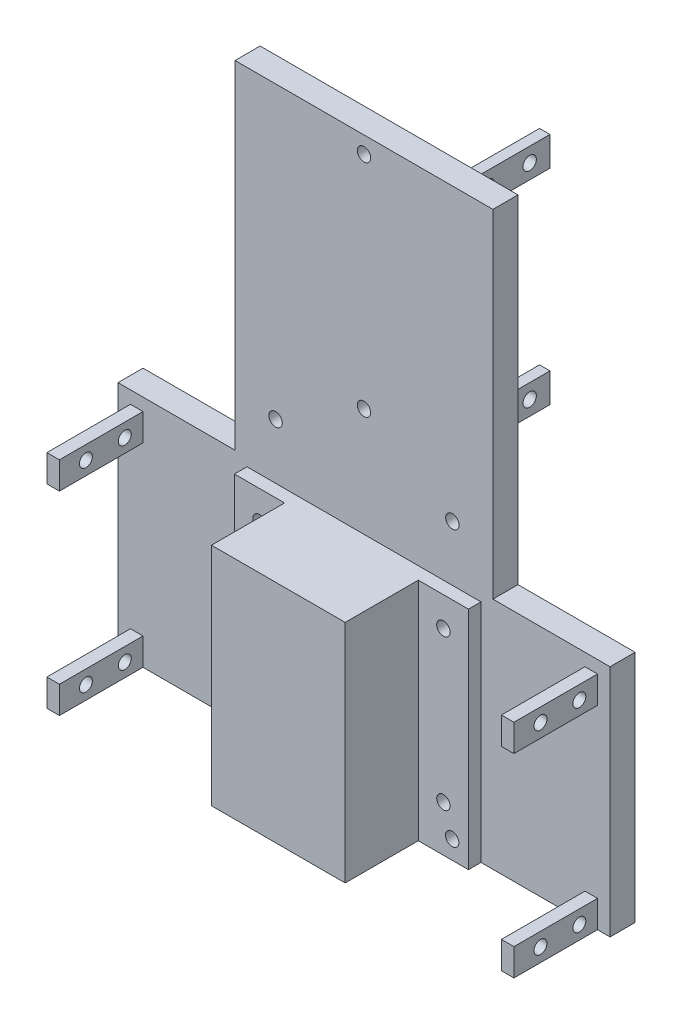
from build123d import *

# Parameters (mm, degrees)
SKETCH1_W           = 132
SKETCH1_H           = 160
BOSS_EXTRUDE1_DEPTH = 6
SKETCH3_W           = 32
SKETCH3_H           = 54
SKETCH3_W_2         = 26
SKETCH3_H_2         = 48
BOSS_EXTRUDE2_DEPTH = 17.5
SKETCH4_W           = 32
SKETCH4_H           = 54
BOSS_EXTRUDE3_DEPTH = 3
SKETCH5_W           = 25
SKETCH5_H           = 17
CUT_EXTRUDE1_DEPTH  = 3
SKETCH6_W           = 12
SKETCH6_H           = 54
BOSS_EXTRUDE4_DEPTH = 3
SKETCH7_R           = 1.6
CUT_EXTRUDE2_DEPTH  = 106.177231376
SKETCH8_W           = 3
SKETCH8_H           = 6.5
BOSS_EXTRUDE5_DEPTH = 20
SKETCH9_R           = 1.55
CUT_EXTRUDE3_DEPTH  = 6
SKETCH10_R          = 1.6
CUT_EXTRUDE4_DEPTH  = 108.043215572
SKETCH11_W          = 2.5
SKETCH11_H          = 7
BOSS_EXTRUDE6_DEPTH = 19.36
SKETCH12_R          = 1.6
CUT_EXTRUDE5_DEPTH  = 19.36
SKETCH13_W          = 3
SKETCH13_H          = 7
BOSS_EXTRUDE7_DEPTH = 15
SKETCH14_R          = 2
CUT_EXTRUDE6_DEPTH  = 15
CUT_EXTRUDE7_START  = -6
CUT_EXTRUDE7_DEPTH  = 6
SKETCH16_R          = 1.6
CUT_EXTRUDE8_DEPTH  = 15


# Read off the part's stored shape, not the designer's step: Cut-Extrude7
with BuildPart() as part:
    # Sketch1 → Boss-Extrude1 (new body)
    with BuildSketch(Plane.XY):
        Rectangle(SKETCH1_W, SKETCH1_H)
    extrude(amount=BOSS_EXTRUDE1_DEPTH)

    # Sketch3 → Boss-Extrude2 (add)
    with BuildSketch(Plane.XY.offset(6)):
        with Locations((0, -53)):
            Rectangle(SKETCH3_W, SKETCH3_H)
        with Locations((0, -53)):
            Rectangle(SKETCH3_W_2, SKETCH3_H_2, mode=Mode.SUBTRACT)
    extrude(amount=BOSS_EXTRUDE2_DEPTH)

    # Sketch4 → Boss-Extrude3 (add)
    with BuildSketch(Plane.XY.offset(23.5)):
        with Locations((0, -53)):
            Rectangle(SKETCH4_W, SKETCH4_H)
    extrude(amount=BOSS_EXTRUDE3_DEPTH)

    # Sketch5 → Cut-Extrude1 (cut)
    with BuildSketch(Plane.XZ.offset(80)):
        with Locations((0, 14.5)):
            Rectangle(SKETCH5_W, SKETCH5_H)
    extrude(amount=-CUT_EXTRUDE1_DEPTH, mode=Mode.SUBTRACT)

    # Sketch6 → Boss-Extrude4 (add)
    with BuildSketch(Plane.XY.offset(6)):
        with Locations((-22, -53)):
            Rectangle(SKETCH6_W, SKETCH6_H)
        with Locations((22, -53)):
            Rectangle(SKETCH6_W, SKETCH6_H)
    extrude(amount=BOSS_EXTRUDE4_DEPTH)

    # Sketch7 → Cut-Extrude2 (cut, through all)
    with BuildSketch(Plane.XY.offset(9)):
        with Locations((-22, -69)):
            Circle(SKETCH7_R)
        with Locations((-22, -33)):
            Circle(SKETCH7_R)
        with Locations(Location((22, -69, 0), (0, 0, 180))):
            Circle(SKETCH7_R)
        with Locations(Location((22, -33, 0), (0, 0, 180))):
            Circle(SKETCH7_R)
    extrude(amount=-CUT_EXTRUDE2_DEPTH, mode=Mode.SUBTRACT)

    # Sketch8 → Boss-Extrude5 (add)
    with BuildSketch(Plane.XY.offset(6)):
        with Locations((-54.38, -76.75)):
            Rectangle(SKETCH8_W, SKETCH8_H)
        with Locations((-54.38, -30.25)):
            Rectangle(SKETCH8_W, SKETCH8_H)
    boss_extrude5 = extrude(amount=BOSS_EXTRUDE5_DEPTH)

    # Sketch9 → Cut-Extrude3 (cut)
    with BuildSketch(Plane.ZY.offset(55.88)):
        with Locations((10.35, -76.75)):
            Circle(SKETCH9_R)
        with Locations((19.65, -76.75)):
            Circle(SKETCH9_R)
        with Locations((10.35, -30.25)):
            Circle(SKETCH9_R)
        with Locations((19.65, -30.25)):
            Circle(SKETCH9_R)
    cut_extrude3 = extrude(amount=-CUT_EXTRUDE3_DEPTH, mode=Mode.SUBTRACT)

    # Mirror1: Boss-Extrude5, Cut-Extrude3 across plane
    add(boss_extrude5.mirror(Plane(origin=(0, 0, 0), x_dir=(0, 0, 1), z_dir=(1, 0, 0))))
    add(cut_extrude3.mirror(Plane(origin=(0, 0, 0), x_dir=(0, 0, 1), z_dir=(1, 0, 0))), mode=Mode.SUBTRACT)

    # Sketch10 → Cut-Extrude4 (cut, through all)
    with BuildSketch(Plane(origin=(0, 0, 0), x_dir=(-1, 0, 0), z_dir=(0, 0, -1))):
        with Locations((-24.1, -75.572749788)):
            Circle(SKETCH10_R)
        with Locations((-21.15, -12.732749788)):
            Circle(SKETCH10_R)
        with Locations(Location((21.15, -12.732749788, 0), (0, 0, 180))):
            Circle(SKETCH10_R)
        with Locations((24.1, -75.572749788)):
            Circle(SKETCH10_R)
    extrude(amount=-CUT_EXTRUDE4_DEPTH, mode=Mode.SUBTRACT)

    # Sketch11 → Boss-Extrude6 (add)
    with BuildSketch(Plane(origin=(0, 0, 0), x_dir=(-1, 0, 0), z_dir=(0, 0, -1))):
        with Locations((-17.9, 1.267250212)):
            Rectangle(SKETCH11_W, SKETCH11_H)
        with Locations((-17.9, 50.267250212)):
            Rectangle(SKETCH11_W, SKETCH11_H)
    extrude(amount=BOSS_EXTRUDE6_DEPTH)

    # Sketch12 → Cut-Extrude5 (cut)
    with BuildSketch(Plane(origin=(19.15, 0, 0), x_dir=(0, 0, -1), z_dir=(1, 0, 0))):
        with Locations(Location((4.5, 50.267250212, 0), (0, 0, 90))):
            Circle(SKETCH12_R)
        with Locations(Location((14.5, 50.267250212, 0), (0, 0, 90))):
            Circle(SKETCH12_R)
        with Locations(Location((4.5, 1.267250212, 0), (0, 0, 90))):
            Circle(SKETCH12_R)
        with Locations(Location((14.5, 1.267250212, 0), (0, 0, 90))):
            Circle(SKETCH12_R)
    extrude(amount=-CUT_EXTRUDE5_DEPTH, mode=Mode.SUBTRACT)

    # Sketch13 → Boss-Extrude7 (add)
    with BuildSketch(Plane(origin=(0, 0, 0), x_dir=(-1, 0, 0), z_dir=(0, 0, -1))):
        with Locations((29.35, 35.967250212)):
            Rectangle(SKETCH13_W, SKETCH13_H)
    extrude(amount=BOSS_EXTRUDE7_DEPTH)

    # Sketch14 → Cut-Extrude6 (cut)
    with BuildSketch(Plane.ZY.offset(30.85)):
        with Locations((-9.9, 35.967250212)):
            Circle(SKETCH14_R)
    extrude(amount=-CUT_EXTRUDE6_DEPTH, mode=Mode.SUBTRACT)

    # Cut-Extrude7 outline → Cut-Extrude7 (cut)
    with BuildSketch(Plane(origin=(0, 0, 0), x_dir=(-1, 0, 0), z_dir=(0, 0, -1)).offset(CUT_EXTRUDE7_START)):
        Polygon((-30.85, 56.767250212), (30.85, 56.767250212), (30.85, -24), (58.88, -24), (58.88, -80), (66, -80), (66, 80), (-66, 80), (-66, -80), (-58.88, -80), (-58.88, -24), (-30.85, -24), align=None)
    extrude(amount=CUT_EXTRUDE7_DEPTH, mode=Mode.SUBTRACT)

    # Sketch16 → Cut-Extrude8 (cut)
    with BuildSketch(Plane(origin=(0, 0, 0), x_dir=(-1, 0, 0), z_dir=(0, 0, -1))):
        Circle(SKETCH16_R)
        with Locations((0, 52.767250212)):
            Circle(SKETCH16_R)
    extrude(amount=-CUT_EXTRUDE8_DEPTH, mode=Mode.SUBTRACT)


solid = part.part
